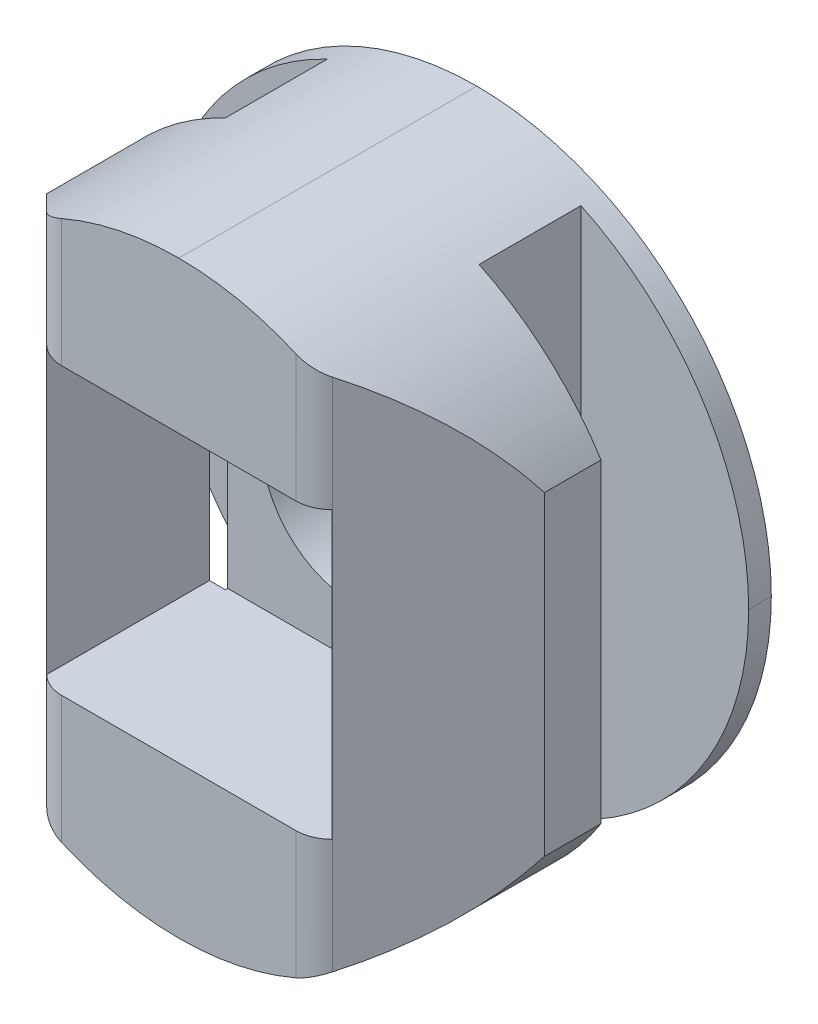
from build123d import *

# Parameters (mm, degrees)
BOSS_EXTRUDE1_DEPTH = 6.5
SKETCH5_R           = 2.05
CUT_EXTRUDE2_DEPTH  = 12.301797423
SKETCH6_R           = 3.05
CUT_EXTRUDE3_DEPTH  = 0.2
FILLET1_R           = 6.5
SKETCH7_W           = 6.3
SKETCH7_H           = 6.3
CUT_EXTRUDE4_DEPTH  = 3.875


with BuildPart() as part:
    # Sketch2 → Boss-Extrude1 (new, symmetric)
    with BuildSketch(Plane(origin=(0, 0, 0), x_dir=(1, 0, 0), z_dir=(0, 1, 0))):
        with BuildLine():
            Line((-2.8, 10), (-2.8, 10.15))
            Line((-2.8, 10.15), (-6.5, 10.15))
            Line((-6.5, 10.15), (-6.5, 10.65))
            Line((-6.5, 10.65), (6.5, 10.65))
            Line((6.5, 10.65), (6.5, 10.15))
            Line((6.5, 10.15), (2.8, 10.15))
            Line((2.8, 10.15), (2.8, 10))
            Line((2.8, 10), (2.8, 7.9))
            Line((2.8, 7.9), (5.492157288, 7.9))
            Line((5.492157288, 7.9), (5.492157288, 6.65))
            Line((5.492157288, 6.65), (3.151471863, 4.309314575))
            ThreePointArc((3.151471863, 4.309314575), (2.891933184, 4.135896374), (2.585786438, 4.075))
            Line((2.585786438, 4.075), (-2.585786438, 4.075))
            ThreePointArc((-2.585786438, 4.075), (-2.891933184, 4.135896374), (-3.151471863, 4.309314575))
            Line((-3.151471863, 4.309314575), (-5.492157288, 6.65))
            Line((-5.492157288, 6.65), (-5.492157288, 7.9))
            Line((-5.492157288, 7.9), (-2.8, 7.9))
            Line((-2.8, 7.9), (-2.8, 10))
        make_face()
    extrude(amount=BOSS_EXTRUDE1_DEPTH, both=True)

    # Sketch5 → Cut-Extrude2 (cut, through all)
    with BuildSketch(Plane(origin=(0, 0, -10.65), x_dir=(-1, 0, 0), z_dir=(0, 0, -1))):
        Circle(SKETCH5_R)
    extrude(amount=-CUT_EXTRUDE2_DEPTH, mode=Mode.SUBTRACT)

    # Sketch6 → Cut-Extrude3 (cut)
    with BuildSketch(Plane(origin=(0, 0, -10.65), x_dir=(-1, 0, 0), z_dir=(0, 0, -1))):
        Circle(SKETCH6_R)
    extrude(amount=-CUT_EXTRUDE3_DEPTH, mode=Mode.SUBTRACT)

    # Fillet1
    fillet1_edges = [part.edges().sort_by_distance(p)[0] for p in [
        (6.5, -6.5, -10.4),
        (-6.5, -6.5, -10.4),
        (6.5, 6.5, -10.4),
        (-6.5, 6.5, -10.4),
    ]]
    fillet(fillet1_edges, radius=FILLET1_R - 0.0001)  # a hair under: the kernel refuses the full size

    # Sketch7 → Cut-Extrude4 (cut)
    with BuildSketch(Plane.XY.offset(-4.075)):
        Rectangle(SKETCH7_W, SKETCH7_H)
    extrude(amount=-CUT_EXTRUDE4_DEPTH, mode=Mode.SUBTRACT)


solid = part.part
